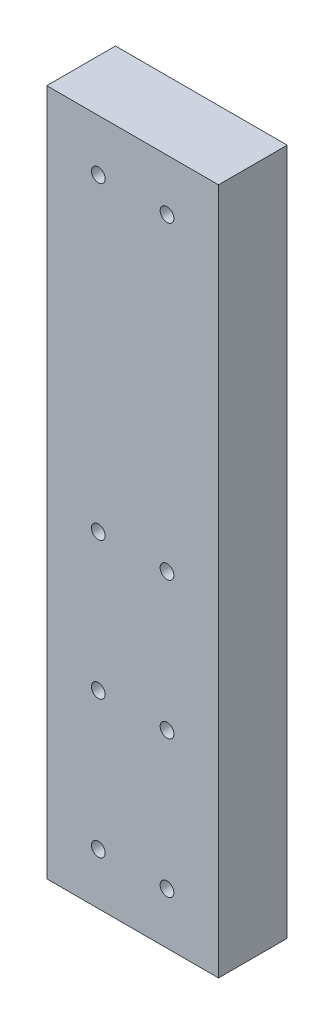
from build123d import *

# Parameters (mm, degrees)
SKETCH1_W           = 25
SKETCH1_H           = 100
BOSS_EXTRUDE1_DEPTH = 10
SKETCH2_R           = 1
CUT_EXTRUDE1_DEPTH  = 104.561575886


with BuildPart() as part:
    # Sketch1 → Boss-Extrude1 (new body)
    with BuildSketch(Plane.XY):
        with Locations((12.5, 50)):
            Rectangle(SKETCH1_W, SKETCH1_H)
    extrude(amount=BOSS_EXTRUDE1_DEPTH)

    # Sketch2 → Cut-Extrude1 (cut, through all)
    with BuildSketch(Plane.XY.offset(10)):
        with Locations((7.5, 92.5)):
            Circle(SKETCH2_R)
        with Locations((7.5, 47.5)):
            Circle(SKETCH2_R)
        with Locations((7.5, 27.5)):
            Circle(SKETCH2_R)
        with Locations((7.5, 7.5)):
            Circle(SKETCH2_R)
        with Locations((17.5, 92.5)):
            Circle(SKETCH2_R)
        with Locations((17.5, 7.5)):
            Circle(SKETCH2_R)
        with Locations((17.5, 27.5)):
            Circle(SKETCH2_R)
        with Locations((17.5, 47.5)):
            Circle(SKETCH2_R)
    extrude(amount=-CUT_EXTRUDE1_DEPTH, mode=Mode.SUBTRACT)


solid = part.part
